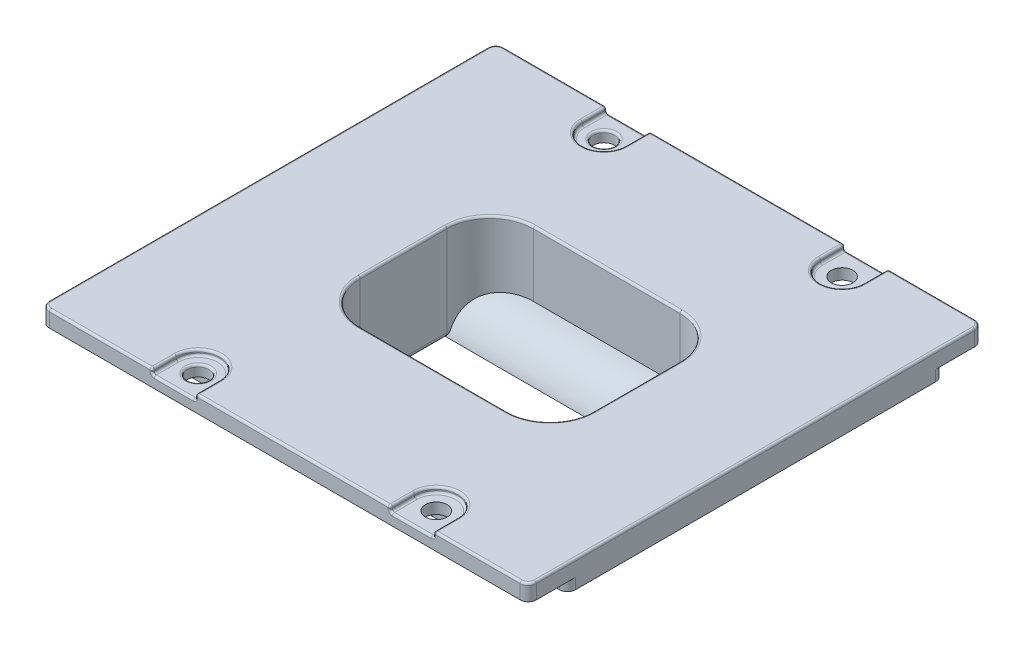
from build123d import *

# Parameters (mm, degrees)
SKETCH1_R           = 2
BOSS_EXTRUDE1_DEPTH = 3
SKETCH2_W           = 87
SKETCH2_H           = 69.5
BOSS_EXTRUDE2_DEPTH = 2
FILLET1_R           = 1.5
CUT_EXTRUDE1_DEPTH  = 1
SKETCH4_W           = 43.1
SKETCH4_H           = 32
CUT_EXTRUDE2_DEPTH  = 63.858969129
FILLET3_R           = 8
FILLET2_R           = 0.4
BOSS_EXTRUDE3_START = 13
BOSS_EXTRUDE3_DEPTH = 13
BOSS_EXTRUDE4_REACH = 84.2
FILLET4_R           = 12
FILLET5_R           = 1


with BuildPart() as part:
    # Sketch1 → Boss-Extrude1 (new body)
    with BuildSketch(Plane(origin=(0, 0, 0), x_dir=(1, 0, 0), z_dir=(0, 1, 0))):
        Polygon((-43.5, 42), (-46.5, 42), (-46.5, -42), (-43.5, -42), (43.5, -42), (43.5, 42), align=None)
        with Locations(Location((-22, 37.5, 0), (0, 0, 270))):
            Circle(SKETCH1_R, mode=Mode.SUBTRACT)
        with Locations(Location((-22, -37.5, 0), (0, 0, 270))):
            Circle(SKETCH1_R, mode=Mode.SUBTRACT)
        with Locations(Location((22, 37.5, 0), (0, 0, 270))):
            Circle(SKETCH1_R, mode=Mode.SUBTRACT)
        with Locations(Location((22, -37.5, 0), (0, 0, 270))):
            Circle(SKETCH1_R, mode=Mode.SUBTRACT)
    extrude(amount=BOSS_EXTRUDE1_DEPTH)

    # Sketch2 → Boss-Extrude2 (add)
    with BuildSketch(Plane(origin=(0, 0, 0), x_dir=(1, 0, 0), z_dir=(0, 1, 0))):
        Rectangle(SKETCH2_W, SKETCH2_H)
    extrude(amount=-BOSS_EXTRUDE2_DEPTH)

    # Fillet1
    fillet1_edges = [part.edges().sort_by_distance(p)[0] for p in [
        (43.5, 1.5, 42),
        (-46.5, 1.5, 42),
        (-46.5, 1.5, -42),
        (43.5, 1.5, -42),
        (43.5, -1, -34.75),
        (43.5, -1, 34.75),
        (-43.5, -1, 34.75),
        (-43.5, -1, -34.75),
    ]]
    fillet(fillet1_edges, radius=FILLET1_R)

    # Sketch3 → Cut-Extrude1 (cut)
    with BuildSketch(Plane(origin=(0, 3, 0), x_dir=(1, 0, 0), z_dir=(0, 1, 0))):
        with BuildLine():
            Line((-26, -37.5), (-26, -42))
            Line((-26, -42), (-18, -42))
            Line((-18, -42), (-18, -37.5))
            ThreePointArc((-18, -37.5), (-22, -33.5), (-26, -37.5))
        make_face()
        with BuildLine():
            Line((-26, 37.5), (-26, 44.426945614))
            Line((-26, 44.426945614), (-18, 44.426945614))
            Line((-18, 44.426945614), (-18, 37.5))
            ThreePointArc((-18, 37.5), (-22, 33.5), (-26, 37.5))
        make_face()
        with BuildLine():
            Line((18, 37.5), (18, 46.59126821))
            Line((18, 46.59126821), (26, 46.59126821))
            Line((26, 46.59126821), (26, 37.5))
            ThreePointArc((26, 37.5), (22, 33.5), (18, 37.5))
        make_face()
        with BuildLine():
            Line((18, -37.5), (18, -43.878379185))
            Line((18, -43.878379185), (26, -43.878379185))
            Line((26, -43.878379185), (26, -37.5))
            ThreePointArc((26, -37.5), (22, -33.5), (18, -37.5))
        make_face()
    extrude(amount=-CUT_EXTRUDE1_DEPTH, mode=Mode.SUBTRACT)

    # Sketch4 → Cut-Extrude2 (cut, through all)
    with BuildSketch(Plane(origin=(0, 3, 0), x_dir=(1, 0, 0), z_dir=(0, 1, 0))):
        Rectangle(SKETCH4_W, SKETCH4_H)
    extrude(amount=-CUT_EXTRUDE2_DEPTH, mode=Mode.SUBTRACT)

    # Fillet3
    fillet3_edges = [part.edges().sort_by_distance(p)[0] for p in [
        (21.55, 0.5, -16),
        (21.55, 0.5, 16),
        (-21.55, 0.5, 16),
        (-21.55, 0.5, -16),
    ]]
    fillet(fillet3_edges, radius=FILLET3_R)

    # Fillet2
    fillet2_edges = [part.edges().sort_by_distance(p)[0] for p in [
        (0, 3, 42),
        (34, 3, 42),
        (18, 2.5, 42),
        (26, 2.5, 42),
        (0, 3, -42),
        (-35.5, 3, -42),
        (-18, 2.5, -42),
        (-26, 2.5, -42),
        (26, 2.5, -42),
        (18, 2.5, -42),
        (26, 3, -39.75),
        (18, 3, -39.75),
        (22, 3, -33.5),
        (26, 2, -39.75),
        (22, 2, -33.5),
        (18, 2, -39.75),
        (22, 2, -42),
        (18, 3, 39.75),
        (26, 3, 39.75),
        (22, 3, 33.5),
        (18, 2, 39.75),
        (22, 2, 33.5),
        (26, 2, 39.75),
        (22, 2, 42),
        (-18, 2.5, 42),
        (-26, 2.5, 42),
        (-22, 3, 33.5),
        (-26, 3, 39.75),
        (-18, 3, 39.75),
        (-22, 2, 35.5),
        (-22, 2, 33.5),
        (-18, 2, 39.75),
        (-22, 2, 42),
        (-26, 2, 39.75),
        (-18, 3, -39.75),
        (-26, 3, -39.75),
        (-22, 3, -33.5),
        (-22, 2, -39.5),
        (-18, 2, -39.75),
        (-22, 2, -33.5),
        (-26, 2, -39.75),
        (-22, 2, -42),
        (-21.55, 3, 0),
        (0, 3, -16),
        (0, 3, 16),
        (21.55, 3, 0),
        (-19.206854249, 3, -13.656854249),
        (-19.206854249, 3, 13.656854249),
        (19.206854249, 3, 13.656854249),
        (19.206854249, 3, -13.656854249),
        (-35.5, 3, 42),
        (-46.5, 3, 0),
        (43.5, 3, 0),
        (34, 3, -42),
        (43.060660172, 3, 41.560660172),
        (43.060660172, 3, -41.560660172),
        (-46.060660172, 3, -41.560660172),
        (-46.060660172, 3, 41.560660172),
    ]]
    fillet(fillet2_edges, radius=FILLET2_R)

    # Sketch5 → Boss-Extrude3 (add)
    with BuildSketch(Plane.XZ.offset(2).offset(BOSS_EXTRUDE3_START)):
        with BuildLine():
            Line((13.55, 20), (-13.55, 20))
            ThreePointArc((-13.55, 20), (-22.035281374, 16.485281374), (-25.55, 8))
            Line((-25.55, 8), (-25.55, -8))
            ThreePointArc((-25.55, -8), (-22.035281374, -16.485281374), (-13.55, -20))
            Line((-13.55, -20), (13.55, -20))
            ThreePointArc((13.55, -20), (22.035281374, -16.485281374), (25.55, -8))
            Line((25.55, -8), (25.55, 8))
            ThreePointArc((25.55, 8), (22.035281374, 16.485281374), (13.55, 20))
        make_face()
        with BuildLine():
            ThreePointArc((-21.55, 8), (-19.206854249, 13.656854249), (-13.55, 16))
            Line((-13.55, 16), (13.55, 16))
            ThreePointArc((13.55, 16), (19.206854249, 13.656854249), (21.55, 8))
            Line((21.55, 8), (21.55, -8))
            ThreePointArc((21.55, -8), (19.206854249, -13.656854249), (13.55, -16))
            Line((13.55, -16), (-13.55, -16))
            ThreePointArc((-13.55, -16), (-19.206854249, -13.656854249), (-21.55, -8))
            Line((-21.55, -8), (-21.55, 8))
        make_face(mode=Mode.SUBTRACT)
    extrude(amount=-BOSS_EXTRUDE3_DEPTH)

    # Boss-Extrude4: up to this face of the body (flat: up to its plane)
    boss_extrude4_end = Plane(part.part.faces().sort_by_distance((25.55, -8.5, 0))[0])
    # Sketch7 → Boss-Extrude4 (add, up to the picked face)
    with BuildSketch(Plane.ZY.offset(25.55), mode=Mode.PRIVATE) as boss_extrude4_sk1:
        with BuildLine():
            Line((-16, -9), (-20, -9))
            Line((-20, -9), (-20, -15))
            Line((-20, -15), (-8.254033308, -15))
            ThreePointArc((-8.254033308, -15), (-11.101020514, -10.67544468), (-16, -9))
        make_face()
    boss_extrude4_tool1 = split(extrude(boss_extrude4_sk1.sketch, amount=-BOSS_EXTRUDE4_REACH, mode=Mode.PRIVATE), bisect_by=boss_extrude4_end, keep=Keep.BOTH, mode=Mode.PRIVATE)
    add(boss_extrude4_tool1.solids().sort_by(Axis((-25.55, -12.295196, -14.973196), (1, 0, 0)))[0])

    # Fillet4
    # the kernel refuses this fillet: 12 mm, written as the material it takes off along each edge
    with BuildSketch(Plane(origin=(25.55, 21, -20), x_dir=(0, 0, 1), z_dir=(0, -1, 0))) as fillet4_piece_1_section:
        with BuildLine():
            CenterArc((FILLET4_R, FILLET4_R), FILLET4_R, 180, 90)
            Line((0, FILLET4_R), (0, 0))
            Line((0, 0), (FILLET4_R, 0))
        make_face()
    fillet4_piece_1 = extrude(amount=66, mode=Mode.PRIVATE)
    fillet4_piece_1 = split(fillet4_piece_1, bisect_by=Plane(origin=(21.484452042, -2, -19.193390061), z_dir=(0, -1, 0)), keep=Keep.TOP, mode=Mode.PRIVATE)
    add(fillet4_piece_1, mode=Mode.SUBTRACT)
    with BuildSketch(Plane(origin=(-25.55, -9, -20), x_dir=(1, 0, 0), z_dir=(0, -1, 0))) as fillet4_piece_2:
        with BuildLine():
            CenterArc((FILLET4_R, FILLET4_R), FILLET4_R, 180, 90)
            Line((0, FILLET4_R), (0, 0))
            Line((0, 0), (FILLET4_R, 0))
        make_face()
    extrude(amount=36, mode=Mode.SUBTRACT)

    # Fillet5
    fillet5_edges = [part.edges().sort_by_distance(p)[0] for p in [
        (-21.55, -15, 0),
        (-21.548991355, -15, -8.12703267),
        (21.55, -15, 0),
        (19.206854249, -15, 13.656854249),
        (0, -15, 16),
        (-19.206854249, -15, 13.656854249),
        (22.035281374, -15, 16.485281374),
        (25.55, -15, 0),
        (22.035281374, -15, -16.485281374),
        (-25.55, -15, 0),
        (-22.035281374, -15, 16.485281374),
        (0, -15, 20),
        (-22.035281374, -15, -16.485281374),
        (21.548991355, -15, -8.12703267),
        (0, -15, -20),
        (-22.035281374, -15, -16.485281374),
        (22.035281374, -15, -16.485281374),
    ]]
    fillet(fillet5_edges, radius=FILLET5_R)


solid = part.part
